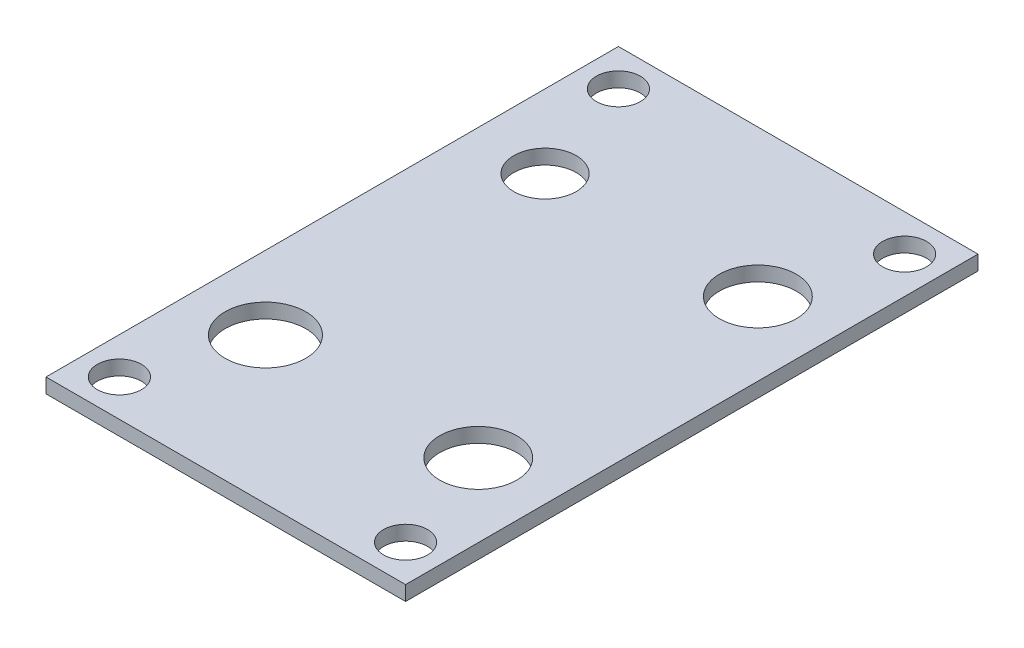
from build123d import *

# Parameters (mm, degrees)
CROQUIS1_W              = 49
CROQUIS1_H              = 73
CROQUIS1_R              = 5.25
CROQUIS1_R_2            = 5.5
CROQUIS1_R_3            = 4.25
CROQUIS1_R_4            = 3
SALIENTE_EXTRUIR4_DEPTH = 2
CROQUIS7_W              = 49
CROQUIS7_H              = 5
SALIENTE_EXTRUIR5_DEPTH = 2
CROQUIS8_R              = 3
CORTAR_EXTRUIR2_DEPTH   = 10


with BuildPart() as part:
    # Croquis1 → Saliente-Extruir4 (new body)
    with BuildSketch(Plane(origin=(0, 0, 0), x_dir=(1, 0, 0), z_dir=(0, 1, 0))):
        with Locations((0, 0.5)):
            Rectangle(CROQUIS1_W, CROQUIS1_H)
        with Locations(Location((14.5, -21.1, 0), (0, 0, 270))):
            Circle(CROQUIS1_R, mode=Mode.SUBTRACT)
        with Locations(Location((-14.5, -21.1, 0), (0, 0, 270))):
            Circle(CROQUIS1_R_2, mode=Mode.SUBTRACT)
        with Locations(Location((-14.5, 17, 0), (0, 0, 270))):
            Circle(CROQUIS1_R_3, mode=Mode.SUBTRACT)
        with Locations(Location((14.5, 17, 0), (0, 0, 270))):
            Circle(CROQUIS1_R, mode=Mode.SUBTRACT)
        with Locations(Location((-19.5, 32, 0), (0, 0, 270))):
            Circle(CROQUIS1_R_4, mode=Mode.SUBTRACT)
        with Locations(Location((19.5, 32, 0), (0, 0, 270))):
            Circle(CROQUIS1_R_4, mode=Mode.SUBTRACT)
    extrude(amount=SALIENTE_EXTRUIR4_DEPTH)

    # Croquis7 → Saliente-Extruir5 (add)
    with BuildSketch(Plane(origin=(0, 2, 0), x_dir=(1, 0, 0), z_dir=(0, 1, 0))):
        with Locations((0, -38.5)):
            Rectangle(CROQUIS7_W, CROQUIS7_H)
    extrude(amount=-SALIENTE_EXTRUIR5_DEPTH)

    # Croquis8 → Cortar-Extruir2 (cut)
    with BuildSketch(Plane(origin=(0, 2, 0), x_dir=(1, 0, 0), z_dir=(0, 1, 0))):
        with Locations(Location((-19.5, -36, 0), (0, 0, 270))):
            Circle(CROQUIS8_R)
        with Locations(Location((19.5, -36, 0), (0, 0, 270))):
            Circle(CROQUIS8_R)
    extrude(amount=-CORTAR_EXTRUIR2_DEPTH, mode=Mode.SUBTRACT)


solid = part.part
